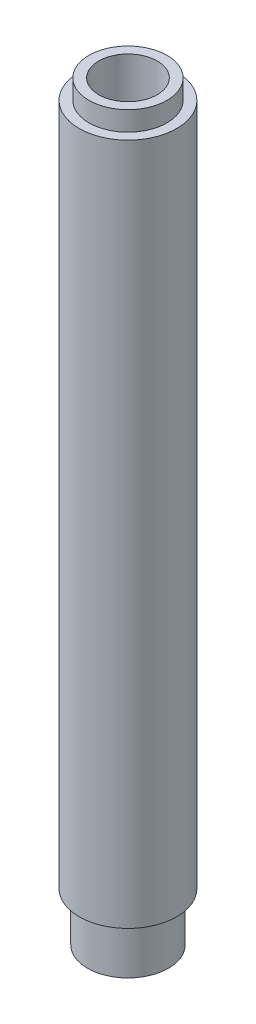
from build123d import *

# Parameters (mm, degrees)
SKETCH1_R           = 12.7
BOSS_EXTRUDE1_DEPTH = 177.8
SKETCH4_R           = 10.16
BOSS_EXTRUDE2_DEPTH = 5.08
SKETCH5_R           = 7.62
CUT_EXTRUDE1_DEPTH  = 184.759828036
SKETCH6_R           = 10.541
SKETCH6_R_2         = 7.62
BOSS_EXTRUDE3_DEPTH = 12.7


with BuildPart() as part:
    # Sketch1 → Boss-Extrude1 (new body)
    with BuildSketch(Plane(origin=(0, 0, 0), x_dir=(1, 0, 0), z_dir=(0, 1, 0))):
        Circle(SKETCH1_R)
    extrude(amount=BOSS_EXTRUDE1_DEPTH)

    # Sketch4 → Boss-Extrude2 (add)
    with BuildSketch(Plane(origin=(0, 177.8, 0), x_dir=(1, 0, 0), z_dir=(0, 1, 0))):
        Circle(SKETCH4_R)
    extrude(amount=BOSS_EXTRUDE2_DEPTH)

    # Sketch5 → Cut-Extrude1 (cut, through all)
    with BuildSketch(Plane(origin=(0, 182.88, 0), x_dir=(1, 0, 0), z_dir=(0, 1, 0))):
        Circle(SKETCH5_R)
    extrude(amount=-CUT_EXTRUDE1_DEPTH, mode=Mode.SUBTRACT)

    # Sketch6 → Boss-Extrude3 (add)
    with BuildSketch(Plane.XZ):
        Circle(SKETCH6_R)
        Circle(SKETCH6_R_2, mode=Mode.SUBTRACT)
    extrude(amount=BOSS_EXTRUDE3_DEPTH)


solid = part.part
